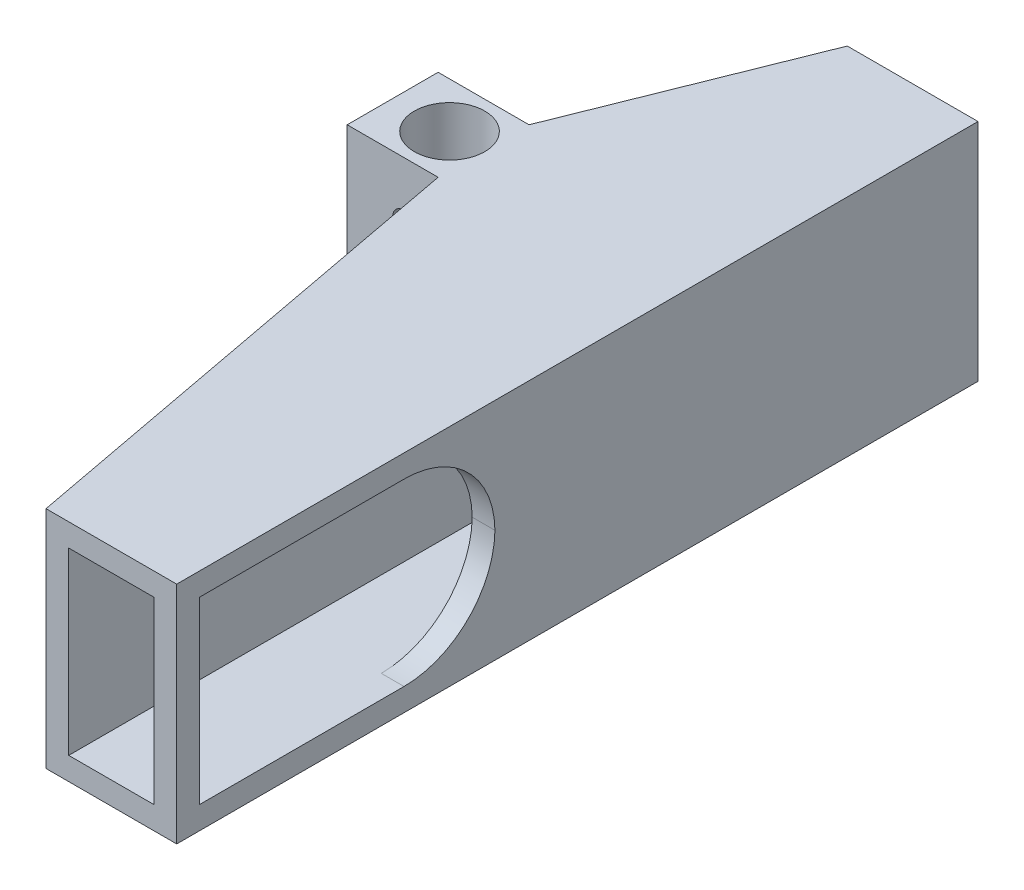
from build123d import *

# Parameters (mm, degrees)
CROQUIS1_W              = 19.8
CROQUIS1_H              = 11.5
SALIENTE_EXTRUIR1_DEPTH = 70.5
VACIADO1_T              = -2
CROQUIS4_W              = 15.8
CROQUIS4_H              = 28
CORTAR_EXTRUIR1_DEPTH   = 2
REDONDEO1_R             = 8
CROQUIS5_W              = 15.8
CROQUIS5_H              = 2
SALIENTE_EXTRUIR2_DEPTH = 2
CROQUIS6_W              = 19.8
CROQUIS6_H              = 8
SALIENTE_EXTRUIR4_DEPTH = 16
CROQUIS8_R              = 1
CORTAR_EXTRUIR3_DEPTH   = 10
SALIENTE_EXTRUIR5_DEPTH = 19.8
CROQUIS10_R             = 3.1
CORTAR_EXTRUIR4_DEPTH   = 19.8


with BuildPart() as part:
    # Croquis1 → Saliente-Extruir1 (new body)
    with BuildSketch(Plane(origin=(0, 0, 0), x_dir=(0, 1, 0), z_dir=(0, 0, 1))):
        Rectangle(CROQUIS1_W, CROQUIS1_H)
    extrude(amount=SALIENTE_EXTRUIR1_DEPTH)

    # Vaciado1
    vaciado1_openings = [part.faces().sort_by_distance(p)[0] for p in [
        (0, 0, 70.5),
    ]]
    offset(amount=VACIADO1_T, openings=vaciado1_openings, kind=Kind.INTERSECTION)

    # Croquis4 → Cortar-Extruir1 (cut)
    with BuildSketch(Plane.YZ.offset(5.75)):
        with Locations((0, 56.5)):
            Rectangle(CROQUIS4_W, CROQUIS4_H)
    extrude(amount=-CORTAR_EXTRUIR1_DEPTH, mode=Mode.SUBTRACT)

    # Redondeo1
    # the kernel refuses this fillet: 8 mm, written as the material it adds along each edge
    with BuildSketch(Plane(origin=(5.75, 7.9, 42.5), x_dir=(0, -1, 0), z_dir=(-1, 0, 0)), Plane(origin=(5.75, -7.9, 42.5), x_dir=(0, 0, 1), z_dir=(-1, 0, 0))) as redondeo1_piece_1:
        with BuildLine():
            CenterArc((REDONDEO1_R, REDONDEO1_R), REDONDEO1_R, 180, 90)
            Line((0, REDONDEO1_R), (0, 0))
            Line((0, 0), (REDONDEO1_R, 0))
        make_face()
    extrude(amount=2)

    # Croquis5 → Saliente-Extruir2 (add)
    with BuildSketch(Plane.YZ.offset(5.75)):
        with Locations((0, 69.5)):
            Rectangle(CROQUIS5_W, CROQUIS5_H)
    extrude(amount=-SALIENTE_EXTRUIR2_DEPTH)

    # Croquis6 → Saliente-Extruir4 (add)
    with BuildSketch(Plane(origin=(-5.75, 0, 0), x_dir=(0, -1, 0), z_dir=(-1, 0, 0))):
        with Locations((0, 24)):
            Rectangle(CROQUIS6_W, CROQUIS6_H)
    extrude(amount=SALIENTE_EXTRUIR4_DEPTH)

    # Croquis8 → Cortar-Extruir3 (cut)
    with BuildSketch(Plane.XY.offset(28)):
        with Locations((-16.75, 4.9)):
            Circle(CROQUIS8_R)
        with Locations((-16.75, -4.9)):
            Circle(CROQUIS8_R)
    extrude(amount=-CORTAR_EXTRUIR3_DEPTH, mode=Mode.SUBTRACT)

    # Croquis9 → Saliente-Extruir5 (add)
    with BuildSketch(Plane.XZ.offset(9.9)):
        Polygon((-5.75, 70.5), (-13.75, 28), (-5.75, 28), align=None)
        Polygon((-5.75, 0), (-13.75, 20), (-5.75, 20), align=None)
    extrude(amount=-SALIENTE_EXTRUIR5_DEPTH)

    # Croquis10 → Cortar-Extruir4 (cut)
    with BuildSketch(Plane.XZ.offset(9.9)):
        with Locations(Location((-16.745253682, 24, 0), (0, 0, 270))):
            Circle(CROQUIS10_R)
    extrude(amount=-CORTAR_EXTRUIR4_DEPTH, mode=Mode.SUBTRACT)


solid = part.part
